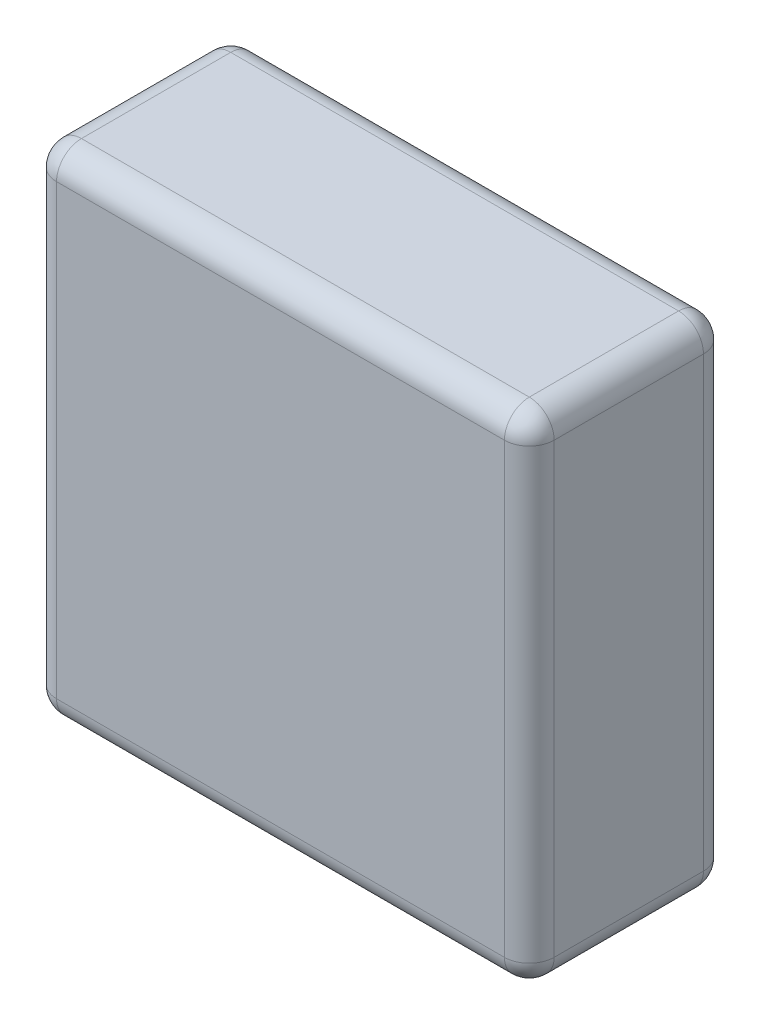
from build123d import *

# Parameters (mm, degrees)
ESQUISSE1_W        = 10
ESQUISSE1_H        = 10
BOSS_EXTRU_1_DEPTH = 4
CONG_1_R           = 0.5


with BuildPart() as part:
    # Esquisse1 → Boss.-Extru.1 (new body)
    with BuildSketch(Plane.XY):
        with Locations((5, -5)):
            Rectangle(ESQUISSE1_W, ESQUISSE1_H)
    extrude(amount=BOSS_EXTRU_1_DEPTH)

    # Congé1
    cong_1_edges = [part.edges().sort_by_distance(p)[0] for p in [
        (0, 0, 2),
        (0, -10, 2),
        (10, -10, 2),
        (10, 0, 2),
        (5, -10, 0),
        (10, -5, 0),
        (5, 0, 0),
        (0, -5, 0),
        (5, 0, 4),
        (10, -5, 4),
        (5, -10, 4),
        (0, -5, 4),
    ]]
    fillet(cong_1_edges, radius=CONG_1_R)


solid = part.part
